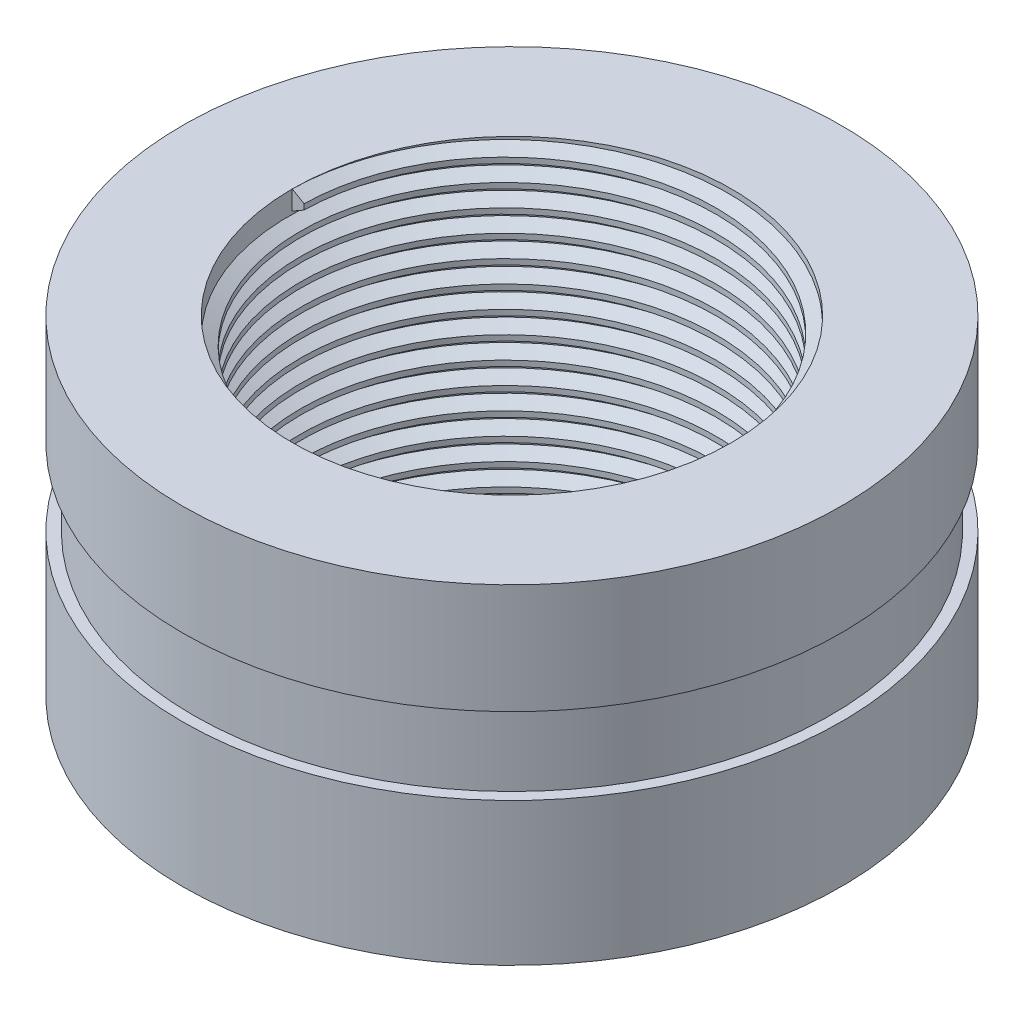
from build123d import *

# Parameters (mm, degrees)
SKETCH1_R           = 30
SKETCH1_R_2         = 20
BOSS_EXTRUDE1_DEPTH = 30
THREAD1_PITCH       = 2
CUT_EXTRUDE1_START  = -7
SKETCH17_R          = 30
SKETCH17_R_2        = 29
CUT_EXTRUDE1_DEPTH  = 7


with BuildPart() as part:
    # Sketch1 → Boss-Extrude1 (new body)
    with BuildSketch(Plane(origin=(0, 0, 0), x_dir=(1, 0, 0), z_dir=(0, 1, 0))):
        with Locations(Location((0, 0, 0), (0, 0, 270))):
            Circle(SKETCH1_R)
        with Locations(Location((0, 0, 0), (0, 0, 270))):
            Circle(SKETCH1_R_2, mode=Mode.SUBTRACT)
    extrude(amount=BOSS_EXTRUDE1_DEPTH)

    # Thread1: the profile of Thread Profile2 profile screwed along a right-hand helix of 15 turns, 10 arcs to a turn; built about Z, then put on its axis
    thread1_z = Axis((0, 0, 0), (0, 0, 1))
    thread1_corners = [(20.0003, 0, -0.000173205), (20.0003, 0, 1.7501732), (18.91746825, 0, 1.124999997), (18.91746825, 0, 0.624999997)]
    with BuildLine(mode=Mode.PRIVATE) as thread1_profile:
        Line(thread1_corners[0], thread1_corners[1])
        Line(thread1_corners[1], thread1_corners[2])
        Line(thread1_corners[2], thread1_corners[3])
        Line(thread1_corners[3], thread1_corners[0])
    thread1_cap = Face(thread1_profile.wire())
    thread1_turn_angles = [0, 18, 36, 54, 72, 90, 108, 126, 144, 162, 180, 198, 216, 234, 252, 270, 288, 306, 324, 342, 360]
    thread1_turn_weights = [1, 0.9510565162951535, 1, 0.9510565162951535, 1, 0.9510565162951535, 1, 0.9510565162951535, 1, 0.9510565162951535, 1, 0.9510565162951535, 1, 0.9510565162951535, 1, 0.9510565162951535, 1, 0.9510565162951535, 1, 0.9510565162951535, 1]
    thread1_turn_rails = [Edge.make_bspline([Vector(p[0], p[1], 0).rotate(thread1_z, thread1_turn_angles[k]) / thread1_turn_weights[k] + Vector(0, 0, p[2] + THREAD1_PITCH * thread1_turn_angles[k] / 360) for k in range(21)], [0, 0, 0, 1, 1, 2, 2, 3, 3, 4, 4, 5, 5, 6, 6, 7, 7, 8, 8, 9, 9, 10, 10, 10], 2, thread1_turn_weights) for p in thread1_corners]
    thread1_turn_sides = [Face.make_surface_from_curves(thread1_turn_rails[p[0]], thread1_turn_rails[p[1]]) for p in [(0, 1), (1, 2), (2, 3), (3, 0)]]
    thread1 = Plane(origin=(0, 30, 0), x_dir=(-1, 0, 0), z_dir=(0, -1, 0)) * Solid(Shell([*[p.moved(Location((0, 0, THREAD1_PITCH * i))) for i in range(15) for p in thread1_turn_sides], thread1_cap, thread1_cap.rotate(thread1_z, 5400).moved(Location((0, 0, THREAD1_PITCH * 5400 / 360)))]))
    add(thread1)

    # Sketch17 → Cut-Extrude1 (cut)
    with BuildSketch(Plane(origin=(0, 20, 0), x_dir=(1, 0, 0), z_dir=(0, 1, 0)).offset(CUT_EXTRUDE1_START)):
        with Locations(Location((0, 0, 0), (0, 0, 270))):
            Circle(SKETCH17_R)
        with Locations(Location((0, 0, 0), (0, 0, 270))):
            Circle(SKETCH17_R_2, mode=Mode.SUBTRACT)
    extrude(amount=CUT_EXTRUDE1_DEPTH, mode=Mode.SUBTRACT)


solid = part.part
